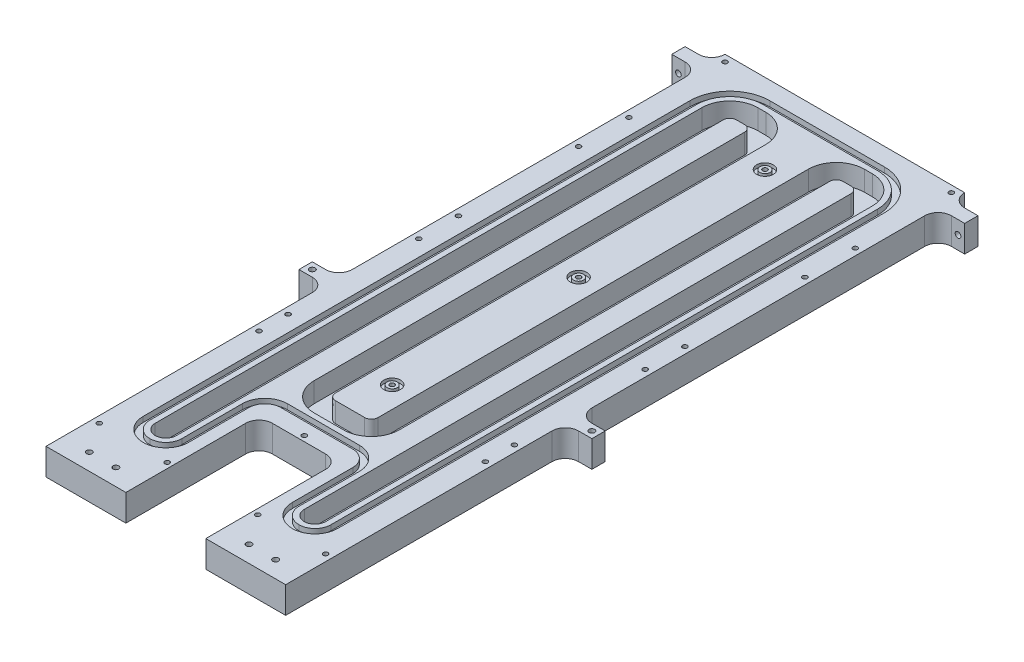
from build123d import *

# Parameters (mm, degrees)
EXTRUDE1_DEPTH                       = 12.7
FILLET1_R                            = 6.35
FILLET2_R                            = 6.35
SKETCH7_W                            = 6.35
SKETCH7_H                            = 12.7
EXTRUDE2_DEPTH                       = 12.7
SKETCH8_W                            = 6.35
SKETCH8_H                            = 12.7
EXTRUDE3_DEPTH                       = 12.7
FILLET3_R                            = 6.35
FILLET8_R                            = 6.35
SKETCH9_W                            = 6.35
SKETCH9_H                            = 12.7
EXTRUDE4_DEPTH                       = 12.7
SKETCH10_W                           = 6.35
SKETCH10_H                           = 12.7
EXTRUDE5_DEPTH                       = 12.7
FILLET9_R                            = 6.35
FILLET10_R                           = 6.35
FILLET11_R                           = 6.35
FILLET12_R                           = 6.35
TAP_DRILL_FOR_4_TAP1_D               = 2.2606
TAP_DRILL_FOR_4_TAP1_DEPTH           = 6.35
TAP_DRILL_FOR_4_TAP1_TIP             = 0.679152758
SKETCH13_R                           = 3.96875
SKETCH13_R_2                         = 2.38125
CUT_EXTRUDE6_DEPTH                   = 1.5875
SKETCH14_R                           = 1.25000004
CUT_EXTRUDE7_DEPTH                   = 6.35
CUT_EXTRUDE8_DEPTH                   = 9.525
FILLET13_R                           = 5.08
FILLET14_R                           = 3.175
CUT_EXTRUDE9_DEPTH                   = 2.54
FILLET15_R                           = 7.62
FILLET16_R                           = 10.795
FILLET17_R                           = 6.35
FILLET18_R                           = 13.335
TAP_DRILL_FOR_6_TAP1_REACH           = 347.667
TAP_DRILL_FOR_6_TAP1_BORE_R          = 1.35255
TAP_DRILL_FOR_6_TAP1_ON_FACE_2_REACH = 234.144
TAP_DRILL_FOR_6_TAP1_BORE_2_R        = 1.35255
FILLET19_R                           = 15.875
FILLET20_R                           = 19.05
TAP_DRILL_FOR_4_TAP2_D               = 2.2606
TAP_DRILL_FOR_4_TAP2_DEPTH           = 6.35
TAP_DRILL_FOR_4_TAP2_TIP             = 0.679152758
TAP_DRILL_FOR_6_TAP2_D               = 2.7051


with BuildPart() as part:
    # Sketch1 → Extrude1 (new body)
    with BuildSketch(Plane(origin=(0, 0, 0), x_dir=(1, 0, 0), z_dir=(0, 1, 0))):
        Polygon((-57.15, -171.45), (-57.15, 152.4), (57.15, 152.4), (57.15, -171.45), (19.05, -171.45), (19.05, -107.95), (-19.05, -107.95), (-19.05, -171.45), align=None)
    extrude(amount=EXTRUDE1_DEPTH)

    # Fillet1
    fillet1_edges = [part.edges().sort_by_distance(p)[0] for p in [
        (-19.05, 6.35, 107.95),
    ]]
    fillet(fillet1_edges, radius=FILLET1_R)

    # Fillet2
    fillet2_edges = [part.edges().sort_by_distance(p)[0] for p in [
        (19.05, 6.35, 107.95),
    ]]
    fillet(fillet2_edges, radius=FILLET2_R)

    # Sketch7 → Extrude2 (add)
    with BuildSketch(Plane(origin=(57.15, 0, 0), x_dir=(0, 0, -1), z_dir=(1, 0, 0))):
        with Locations((142.875, 6.35)):
            Rectangle(SKETCH7_W, SKETCH7_H)
    extrude(amount=EXTRUDE2_DEPTH)

    # Sketch8 → Extrude3 (add)
    with BuildSketch(Plane.ZY.offset(57.15)):
        with Locations((-142.875, 6.35)):
            Rectangle(SKETCH8_W, SKETCH8_H)
    extrude(amount=EXTRUDE3_DEPTH)

    # Fillet3
    fillet3_edges = [part.edges().sort_by_distance(p)[0] for p in [
        (57.15, 6.35, -139.7),
    ]]
    fillet(fillet3_edges, radius=FILLET3_R)

    # Fillet8
    fillet8_edges = [part.edges().sort_by_distance(p)[0] for p in [
        (-57.15, 6.35, -139.7),
    ]]
    fillet(fillet8_edges, radius=FILLET8_R)

    # Sketch9 → Extrude4 (add)
    with BuildSketch(Plane.ZY.offset(57.15)):
        with Locations((34.925, 6.35)):
            Rectangle(SKETCH9_W, SKETCH9_H)
    extrude(amount=EXTRUDE4_DEPTH)

    # Sketch10 → Extrude5 (add)
    with BuildSketch(Plane(origin=(57.15, 0, 0), x_dir=(0, 0, -1), z_dir=(1, 0, 0))):
        with Locations((-34.925, 6.35)):
            Rectangle(SKETCH10_W, SKETCH10_H)
    extrude(amount=EXTRUDE5_DEPTH)

    # Fillet9
    fillet9_edges = [part.edges().sort_by_distance(p)[0] for p in [
        (57.15, 6.35, 38.1),
    ]]
    fillet(fillet9_edges, radius=FILLET9_R)

    # Fillet10
    fillet10_edges = [part.edges().sort_by_distance(p)[0] for p in [
        (57.15, 6.35, 31.75),
    ]]
    fillet(fillet10_edges, radius=FILLET10_R)

    # Fillet11
    fillet11_edges = [part.edges().sort_by_distance(p)[0] for p in [
        (-57.15, 6.35, 38.1),
    ]]
    fillet(fillet11_edges, radius=FILLET11_R)

    # Fillet12
    fillet12_edges = [part.edges().sort_by_distance(p)[0] for p in [
        (-57.15, 6.35, 31.75),
    ]]
    fillet(fillet12_edges, radius=FILLET12_R)

    # Tap Drill for #4 Tap1
    with Locations(Plane(origin=(-53.975, 12.7, -149.225), x_dir=(0, 0, 1), z_dir=(0, 1, 0))):
        with Locations((0, 0), (0, 107.95), (298.45, 107.95), (298.45, 75.565), (254.635, 53.975), (298.45, 32.385), (298.45, 0), (69.85, 0), (146.05, 0), (222.25, 0), (222.25, 107.95), (146.05, 107.95), (69.85, 107.95), (34.925, 53.975), (212.725, 53.975), (123.825, 53.975)):
            Hole(TAP_DRILL_FOR_4_TAP1_D / 2, depth=TAP_DRILL_FOR_4_TAP1_DEPTH)
            with Locations((0, 0, -(TAP_DRILL_FOR_4_TAP1_DEPTH + TAP_DRILL_FOR_4_TAP1_TIP / 2))):  # 118° drill point
                Cone(0, TAP_DRILL_FOR_4_TAP1_D / 2, TAP_DRILL_FOR_4_TAP1_TIP, mode=Mode.SUBTRACT)

    # Sketch13 → Cut-Extrude6 (cut)
    # profile 1 of 3: a face of its own
    with BuildSketch(Plane(origin=(0, 12.7, 0), x_dir=(-1, 0, 0), z_dir=(0, 1, 0))):
        with Locations(Location((0, -114.3, 0), (0, 0, 90))):
            Circle(SKETCH13_R)
        with Locations(Location((0, -114.3, 0), (0, 0, 90))):
            Circle(SKETCH13_R_2, mode=Mode.SUBTRACT)
    # profile 2 of 3: a face of its own
    with BuildSketch(Plane(origin=(0, 12.7, 0), x_dir=(-1, 0, 0), z_dir=(0, 1, 0))):
        with Locations(Location((0, -25.4, 0), (0, 0, 90))):
            Circle(SKETCH13_R)
        with Locations(Location((0, -25.4, 0), (0, 0, 90))):
            Circle(SKETCH13_R_2, mode=Mode.SUBTRACT)
    # profile 3 of 3: a face of its own
    with BuildSketch(Plane(origin=(0, 12.7, 0), x_dir=(-1, 0, 0), z_dir=(0, 1, 0))):
        with Locations(Location((0, 63.5, 0), (0, 0, 90))):
            Circle(SKETCH13_R)
        with Locations(Location((0, 63.5, 0), (0, 0, 90))):
            Circle(SKETCH13_R_2, mode=Mode.SUBTRACT)
    extrude(amount=-CUT_EXTRUDE6_DEPTH, mode=Mode.SUBTRACT)

    # Sketch14 → Cut-Extrude7 (cut)
    with BuildSketch(Plane.XZ):
        with Locations(Location((-45.000000043, 100.4749998, 0), (0, 0, 270))):
            Circle(SKETCH14_R)
        with Locations(Location((45.000000043, 100.4749998, 0), (0, 0, 270))):
            Circle(SKETCH14_R)
        with Locations(Location((-45.000000043, -7.5250001, 0), (0, 0, 270))):
            Circle(SKETCH14_R)
        with Locations(Location((45.000000043, -7.5250001, 0), (0, 0, 270))):
            Circle(SKETCH14_R)
        with Locations(Location((45.000000043, -28.5250001, 0), (0, 0, 90))):
            Circle(SKETCH14_R)
        with Locations(Location((-45.000000043, -28.5250001, 0), (0, 0, 90))):
            Circle(SKETCH14_R)
        with Locations(Location((45.000000043, -136.525, 0), (0, 0, 90))):
            Circle(SKETCH14_R)
        with Locations(Location((-45.000000043, -136.525, 0), (0, 0, 90))):
            Circle(SKETCH14_R)
    extrude(amount=-CUT_EXTRUDE7_DEPTH, mode=Mode.SUBTRACT)

    # Sketch16 → Cut-Extrude8 (cut)
    with BuildSketch(Plane(origin=(0, 12.7, 0), x_dir=(-1, 0, 0), z_dir=(0, 1, 0))):
        Polygon((20.32, 93.726), (-20.32, 93.726), (-20.32, -128.016), (-30.48, -128.016), (-30.48, 140.97), (-40.64, 140.97), (-40.64, -138.176), (-10.16, -138.176), (-10.16, 83.566), (10.16, 83.566), (10.16, -138.176), (40.64, -138.176), (40.64, 140.97), (30.48, 140.97), (30.48, -128.016), (20.32, -128.016), align=None)
    extrude(amount=-CUT_EXTRUDE8_DEPTH, mode=Mode.SUBTRACT)

    # Fillet13
    fillet13_edges = [part.edges().sort_by_distance(p)[0] for p in [
        (40.64, 7.9375, 140.97),
        (-30.48, 7.9375, 140.97),
        (30.48, 7.9375, 140.97),
        (-40.64, 7.9375, 140.97),
    ]]
    fillet(fillet13_edges, radius=FILLET13_R - 0.0001)  # a hair under: the kernel refuses the full size

    # Fillet14
    fillet14_edges = [part.edges().sort_by_distance(p)[0] for p in [
        (-10.16, 7.9375, 83.566),
        (10.16, 7.9375, 83.566),
        (30.48, 7.9375, -128.016),
        (20.32, 7.9375, -128.016),
        (-20.32, 7.9375, -128.016),
        (-30.48, 7.9375, -128.016),
    ]]
    fillet(fillet14_edges, radius=FILLET14_R)

    # Sketch17 → Cut-Extrude9 (cut)
    with BuildSketch(Plane(origin=(0, 12.7, 0), x_dir=(-1, 0, 0), z_dir=(0, 1, 0))):
        Polygon((46.355, 146.685), (24.765, 146.685), (24.765, 99.441), (-24.765, 99.441), (-24.765, 146.685), (-46.355, 146.685), (-46.355, -143.891), (46.355, -143.891), align=None)
        Polygon((43.18, 143.51), (43.18, -140.716), (-43.18, -140.716), (-43.18, 143.51), (-27.94, 143.51), (-27.94, 96.266), (27.94, 96.266), (27.94, 143.51), align=None, mode=Mode.SUBTRACT)
    extrude(amount=-CUT_EXTRUDE9_DEPTH, mode=Mode.SUBTRACT)

    # Fillet15
    fillet15_edges = [part.edges().sort_by_distance(p)[0] for p in [
        (43.18, 11.43, 143.51),
        (27.94, 11.43, 143.51),
        (-27.94, 11.43, 143.51),
        (-43.18, 11.43, 143.51),
        (24.765, 11.43, 99.441),
        (-24.765, 11.43, 99.441),
    ]]
    fillet(fillet15_edges, radius=FILLET15_R - 0.0001)  # a hair under: the kernel refuses the full size

    # Fillet16
    fillet16_edges = [part.edges().sort_by_distance(p)[0] for p in [
        (24.765, 11.43, 146.685),
        (-46.355, 11.43, 146.685),
        (46.355, 11.43, 146.685),
        (-24.765, 11.43, 146.685),
        (27.94, 11.43, 96.266),
        (-27.94, 11.43, 96.266),
    ]]
    fillet(fillet16_edges, radius=FILLET16_R - 0.0001)  # a hair under: the kernel refuses the full size

    # Fillet17
    fillet17_edges = [part.edges().sort_by_distance(p)[0] for p in [
        (57.15, 6.35, -146.05),
        (-57.15, 6.35, -146.05),
    ]]
    fillet(fillet17_edges, radius=FILLET17_R - 0.0001)  # a hair under: the kernel refuses the full size

    # Fillet18
    fillet18_edges = [part.edges().sort_by_distance(p)[0] for p in [
        (-40.64, 7.9375, -138.176),
        (-10.16, 7.9375, -138.176),
        (10.16, 7.9375, -138.176),
        (40.64, 7.9375, -138.176),
        (20.32, 7.9375, 93.726),
        (-20.32, 7.9375, 93.726),
    ]]
    fillet(fillet18_edges, radius=FILLET18_R)

    # Tap Drill for #6 Tap1 bore (on position points) → Tap Drill for #6 Tap1 (cut, up to next)
    with BuildSketch(Plane(origin=(-66.675, 6.35, -146.05), x_dir=(0, -1, 0), z_dir=(0, 0, -1)), mode=Mode.PRIVATE) as tap_drill_for_6_tap1_sk1:
        Circle(TAP_DRILL_FOR_6_TAP1_BORE_R)
    tap_drill_for_6_tap1_tool1 = extrude(tap_drill_for_6_tap1_sk1.sketch, amount=-TAP_DRILL_FOR_6_TAP1_REACH, mode=Mode.PRIVATE) & part.part
    # Tap Drill for #6 Tap1 bore (on position points) → Tap Drill for #6 Tap1 (cut, up to next)
    with BuildSketch(Plane(origin=(-66.675, 6.35, -146.05), x_dir=(0, -1, 0), z_dir=(0, 0, -1)), mode=Mode.PRIVATE) as tap_drill_for_6_tap1_sk2:
        with Locations((0, -133.35)):
            Circle(TAP_DRILL_FOR_6_TAP1_BORE_R)
    tap_drill_for_6_tap1_tool2 = extrude(tap_drill_for_6_tap1_sk2.sketch, amount=-TAP_DRILL_FOR_6_TAP1_REACH, mode=Mode.PRIVATE) & part.part
    add(tap_drill_for_6_tap1_tool1.solids().sort_by_distance((-66.675, 6.35, -146.05))[0], mode=Mode.SUBTRACT)
    add(tap_drill_for_6_tap1_tool2.solids().sort_by_distance((66.675, 6.35, -146.05))[0], mode=Mode.SUBTRACT)

    # Tap Drill for #6 Tap1 bore 2 (on position points) → Tap Drill for #6 Tap1 on face 2 (cut, up to next)
    with BuildSketch(Plane(origin=(-66.675, 12.7, 34.925), x_dir=(0, 0, 1), z_dir=(0, 1, 0)), mode=Mode.PRIVATE) as tap_drill_for_6_tap1_on_face_2_sk1:
        Circle(TAP_DRILL_FOR_6_TAP1_BORE_2_R)
    tap_drill_for_6_tap1_on_face_2_tool1 = extrude(tap_drill_for_6_tap1_on_face_2_sk1.sketch, amount=-TAP_DRILL_FOR_6_TAP1_ON_FACE_2_REACH, mode=Mode.PRIVATE) & part.part
    # Tap Drill for #6 Tap1 bore 2 (on position points) → Tap Drill for #6 Tap1 on face 2 (cut, up to next)
    with BuildSketch(Plane(origin=(-66.675, 12.7, 34.925), x_dir=(0, 0, 1), z_dir=(0, 1, 0)), mode=Mode.PRIVATE) as tap_drill_for_6_tap1_on_face_2_sk2:
        with Locations((0, 133.35)):
            Circle(TAP_DRILL_FOR_6_TAP1_BORE_2_R)
    tap_drill_for_6_tap1_on_face_2_tool2 = extrude(tap_drill_for_6_tap1_on_face_2_sk2.sketch, amount=-TAP_DRILL_FOR_6_TAP1_ON_FACE_2_REACH, mode=Mode.PRIVATE) & part.part
    add(tap_drill_for_6_tap1_on_face_2_tool1.solids().sort_by_distance((-66.675, 12.7, 34.925))[0], mode=Mode.SUBTRACT)
    add(tap_drill_for_6_tap1_on_face_2_tool2.solids().sort_by_distance((66.675, 12.7, 34.925))[0], mode=Mode.SUBTRACT)

    # Fillet19
    fillet19_edges = [part.edges().sort_by_distance(p)[0] for p in [
        (-43.18, 11.43, -140.716),
        (43.18, 11.43, -140.716),
    ]]
    fillet(fillet19_edges, radius=FILLET19_R)

    # Fillet20
    fillet20_edges = [part.edges().sort_by_distance(p)[0] for p in [
        (-46.355, 11.43, -143.891),
        (46.355, 11.43, -143.891),
    ]]
    fillet(fillet20_edges, radius=FILLET20_R)

    # Tap Drill for #4 Tap2
    with Locations(Plane(origin=(-53.975, 12.7, -103.378), x_dir=(0, 0, 1), z_dir=(0, 1, 0))):
        with Locations((0, 0), (81.28, 0), (162.56, 0), (162.56, 107.95), (81.28, 107.95), (0, 107.95)):
            Hole(TAP_DRILL_FOR_4_TAP2_D / 2, depth=TAP_DRILL_FOR_4_TAP2_DEPTH)
            with Locations((0, 0, -(TAP_DRILL_FOR_4_TAP2_DEPTH + TAP_DRILL_FOR_4_TAP2_TIP / 2))):  # 118° drill point
                Cone(0, TAP_DRILL_FOR_4_TAP2_D / 2, TAP_DRILL_FOR_4_TAP2_TIP, mode=Mode.SUBTRACT)

    # Tap Drill for #6 Tap2 (through all)
    with Locations(Plane(origin=(-44.45, 12.7, 163.5125), x_dir=(0, 0, 1), z_dir=(0, 1, 0))):
        with Locations((0, 0), (0, 12.7), (0, 76.2), (0, 88.9)):
            Hole(TAP_DRILL_FOR_6_TAP2_D / 2)


solid = part.part
